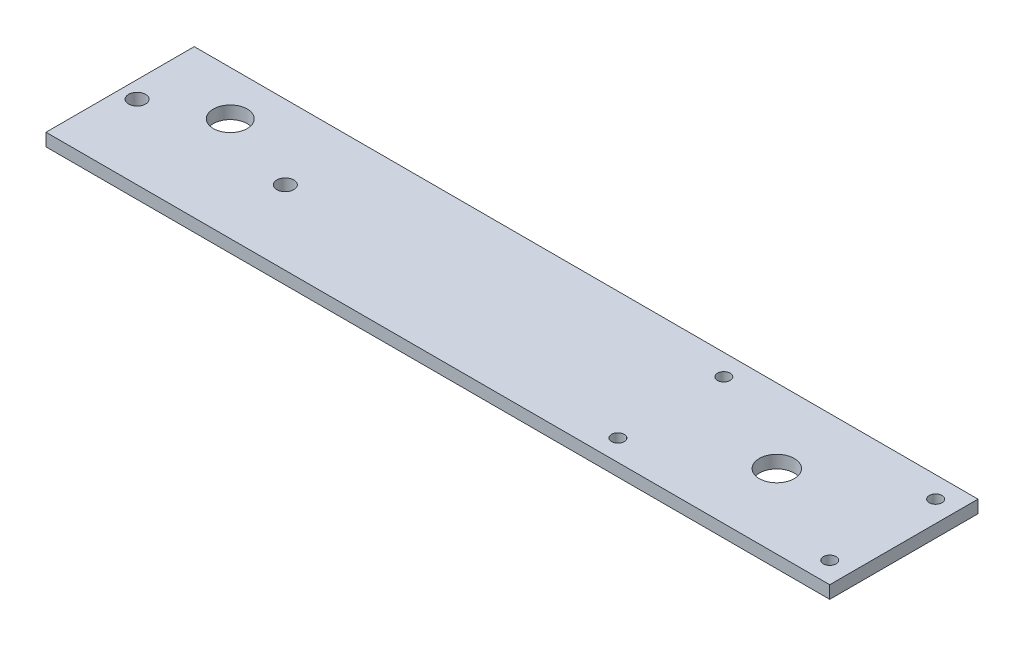
from build123d import *

# Parameters (mm, degrees)
SKETCH1_W           = 185
SKETCH1_H           = 35
SKETCH1_R           = 4.125
SKETCH1_R_2         = 2
SKETCH1_R_3         = 4
BOSS_EXTRUDE1_DEPTH = 3
SKETCH6_R           = 1.5
CUT_EXTRUDE6_DEPTH  = 95.188640504


with BuildPart() as part:
    # Sketch1 → Boss-Extrude1 (new body)
    with BuildSketch(Plane(origin=(0, 0, 0), x_dir=(1, 0, 0), z_dir=(0, 1, 0))):
        Rectangle(SKETCH1_W, SKETCH1_H)
        with Locations((62.5, 0)):
            Circle(SKETCH1_R, mode=Mode.SUBTRACT)
        with Locations((-88.5, 0)):
            Circle(SKETCH1_R_2, mode=Mode.SUBTRACT)
        with Locations((-53.5, 0)):
            Circle(SKETCH1_R_2, mode=Mode.SUBTRACT)
        with Locations((-73.5, 7)):
            Circle(SKETCH1_R_3, mode=Mode.SUBTRACT)
    extrude(amount=BOSS_EXTRUDE1_DEPTH)

    # Sketch6 → Cut-Extrude6 (cut, through all)
    with BuildSketch(Plane(origin=(0, 3, 0), x_dir=(1, 0, 0), z_dir=(0, 1, 0))):
        with Locations((87.5, 12.5)):
            Circle(SKETCH6_R)
        with Locations((87.5, -12.5)):
            Circle(SKETCH6_R)
        with Locations((37.5, -12.5)):
            Circle(SKETCH6_R)
        with Locations((37.5, 12.5)):
            Circle(SKETCH6_R)
    extrude(amount=-CUT_EXTRUDE6_DEPTH, mode=Mode.SUBTRACT)


solid = part.part
